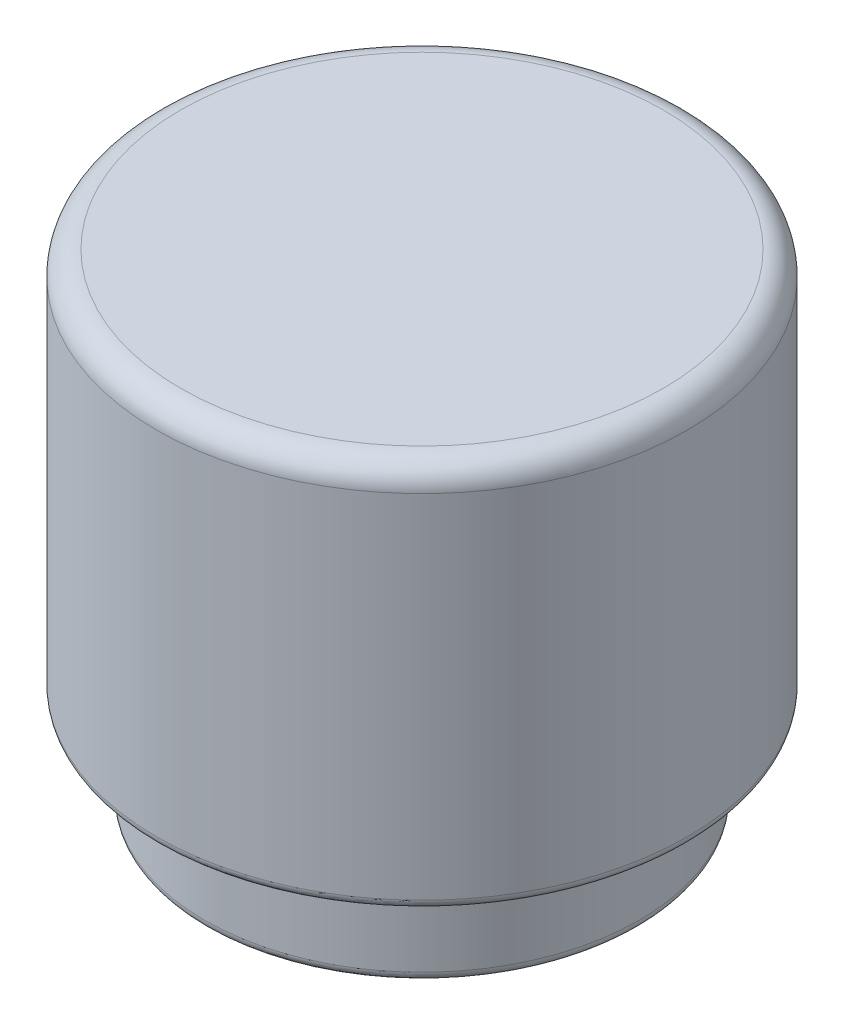
from build123d import *

# Parameters (mm, degrees)
FILLET1_R = 0.5
FILLET2_R = 0.2


with BuildPart() as part:
    # Sketch1 → Revolve1 (revolve)
    with BuildSketch(Plane(origin=(0, 0, 0), x_dir=(0, 0, -1), z_dir=(1, 0, 0))):
        Polygon((0, 0), (-5.5, 0), (-5.5, -8), (-4.5, -8), (-4.5, -10), (-4, -10), (-4, -7.5), (-5, -7.5), (-5, -0.5), (0, -0.5), align=None)
    revolve(axis=Axis((0, 0, 0), (0, -1, 0)))

    # Fillet1
    fillet1_edges = [part.edges().sort_by_distance(p)[0] for p in [
        (0, 0, -5.5),
    ]]
    fillet(fillet1_edges, radius=FILLET1_R)

    # Fillet2
    fillet2_edges = [part.edges().sort_by_distance(p)[0] for p in [
        (0, -0.5, -5),
        (0, -7.5, -4),
        (0, -10, -4),
        (0, -10, -4.5),
        (0, -8, -5.5),
    ]]
    fillet(fillet2_edges, radius=FILLET2_R)


solid = part.part
